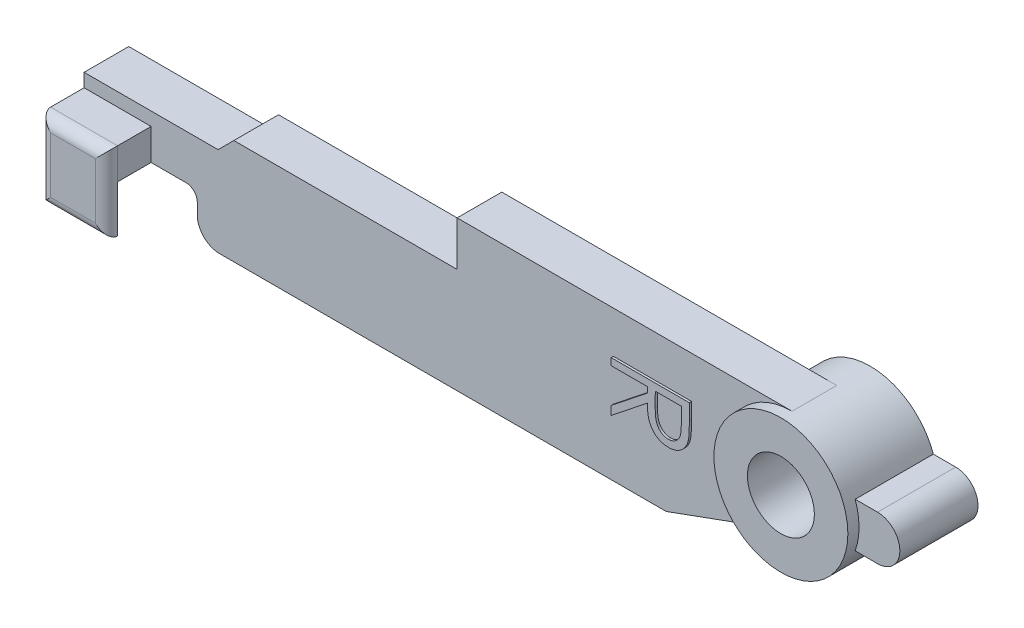
from build123d import *

# Parameters (mm, degrees)
ESTRUSIONE_ESTRUSIONE1_DEPTH             = 2
RACCORDO1_R                              = 1
RACCORDO2_R                              = 0.5
ESTRUSIONE_ESTRUSIONE2_DEPTH             = 2.5
ESTRUSIONE_ESTRUSIONE2_DEPTH_BACK        = 1.5
SCHIZZO2_R                               = 3
ESTRUSIONE_ESTRUSIONE3_REACH             = 20.507
ESTRUSIONE_ESTRUSIONE3_DIRECTION_2_REACH = 20.507
ESTRUSIONE_ESTRUSIONE4_DEPTH             = 3
RACCORDO3_R                              = 0.5
SCHIZZO5_R                               = 1.5
TAGLIO_ESTRUSIONE1_DEPTH                 = 21.528432045
ESTRUSIONE_ESTRUSIONE5_DEPTH             = 0.1


with BuildPart() as part:
    # Schizzo1 → Estrusione-Estrusione1 (new body)
    with BuildSketch(Plane.XY):
        Polygon((-16.707106781, 0.792893219), (-10.707106781, 0.792893219), (-10, 1.5), (0, 1.5), (0, 3.5), (15, 3.5), (15, 0), (15, -1.154985921), (9.361844275, -3.207106781), (-11.638155725, -3.207106781), (-11.638155725, -1.207106781), (-16.707106781, -1.207106781), align=None)
    extrude(amount=ESTRUSIONE_ESTRUSIONE1_DEPTH)

    # Raccordo1
    raccordo1_edges = [part.edges().sort_by_distance(p)[0] for p in [
        (-11.638155725, -3.207106781, 1),
    ]]
    fillet(raccordo1_edges, radius=RACCORDO1_R)

    # Raccordo2
    raccordo2_edges = [part.edges().sort_by_distance(p)[0] for p in [
        (-11.638155725, -1.207106781, 1),
    ]]
    fillet(raccordo2_edges, radius=RACCORDO2_R)

    # Schizzo2 → Estrusione-Estrusione2 (add, two sides: drawn at the far end of the back side and taken through both)
    with BuildSketch(Plane.XY.offset(-ESTRUSIONE_ESTRUSIONE2_DEPTH_BACK)):
        with Locations((15, 0.5)):
            Circle(SCHIZZO2_R)
    extrude(amount=ESTRUSIONE_ESTRUSIONE2_DEPTH + ESTRUSIONE_ESTRUSIONE2_DEPTH_BACK)

    # Estrusione-Estrusione3: up to this face of the body (flat: up to its plane)
    estrusione_estrusione3_end = Plane(part.part.faces().sort_by_distance((0.378494116, -0.204899382, 2))[0])
    # Schizzo3 → Estrusione-Estrusione3 (add, up to the picked face)
    with BuildSketch(Plane.XY, mode=Mode.PRIVATE) as estrusione_estrusione3_sk1:
        with BuildLine():
            Line((18.828427125, 1.5), (17.828427125, 1.5))
            ThreePointArc((17.828427125, 1.5), (18, 0.5), (17.828427125, -0.5))
            Line((17.828427125, -0.5), (18.828427125, -0.5))
            ThreePointArc((18.828427125, -0.5), (19.828427125, 0.5), (18.828427125, 1.5))
        make_face()
    estrusione_estrusione3_tool1 = split(extrude(estrusione_estrusione3_sk1.sketch, amount=ESTRUSIONE_ESTRUSIONE3_REACH, mode=Mode.PRIVATE), bisect_by=estrusione_estrusione3_end, keep=Keep.BOTH, mode=Mode.PRIVATE)
    add(estrusione_estrusione3_tool1.solids().sort_by(Axis((18.792788, 0.5, 0), (0, 0, 1)))[0])

    # Estrusione-Estrusione3 direction 2: up to this face of the body (flat: up to its plane)
    estrusione_estrusione3_direction_2_end = Plane(part.part.faces().sort_by_distance((15, 0.5, -1.5))[0])
    # Schizzo3 → Estrusione-Estrusione3 direction 2 (add, up to the picked face)
    with BuildSketch(Plane.XY, mode=Mode.PRIVATE) as estrusione_estrusione3_direction_2_sk1:
        with BuildLine():
            Line((18.828427125, 1.5), (17.828427125, 1.5))
            ThreePointArc((17.828427125, 1.5), (18, 0.5), (17.828427125, -0.5))
            Line((17.828427125, -0.5), (18.828427125, -0.5))
            ThreePointArc((18.828427125, -0.5), (19.828427125, 0.5), (18.828427125, 1.5))
        make_face()
    estrusione_estrusione3_direction_2_tool1 = split(extrude(estrusione_estrusione3_direction_2_sk1.sketch, amount=-ESTRUSIONE_ESTRUSIONE3_DIRECTION_2_REACH, mode=Mode.PRIVATE), bisect_by=estrusione_estrusione3_direction_2_end, keep=Keep.BOTH, mode=Mode.PRIVATE)
    add(estrusione_estrusione3_direction_2_tool1.solids().sort_by(Axis((18.792788, 0.5, 0), (0, 0, -1)))[0])

    # Schizzo4 → Estrusione-Estrusione4 (add)
    with BuildSketch(Plane.ZY.offset(16.707106781)):
        Polygon((2, -1.207106781), (3.5, -1.207106781), (3.5, -3.307106781), (4, -3.307106781), (4, 0.192893219), (2, 0.192893219), align=None)
    extrude(amount=-ESTRUSIONE_ESTRUSIONE4_DEPTH)

    # Raccordo3
    raccordo3_edges = [part.edges().sort_by_distance(p)[0] for p in [
        (-15.207106781, 0.192893219, 4),
        (-13.707106781, -1.557106781, 4),
        (-15.207106781, -3.307106781, 4),
        (-16.707106781, -1.557106781, 4),
    ]]
    fillet(raccordo3_edges, radius=RACCORDO3_R - 0.0001)  # a hair under: the kernel refuses the full size

    # Schizzo5 → Taglio-Estrusione1 (cut, through all)
    with BuildSketch(Plane.XY.offset(2.5)):
        with Locations((15, 0.5)):
            Circle(SCHIZZO5_R)
    extrude(amount=-TAGLIO_ESTRUSIONE1_DEPTH, mode=Mode.SUBTRACT)

    # Schizzo6 → Estrusione-Estrusione5 (add)
    with BuildSketch(Plane.XY.offset(2)):
        with BuildLine():
            Line((10.5, 1.629867893), (10.5, 0.92944722))
            add(Edge.make_bspline(
                [(10.5, 0.92944722), (10.499844414, 0.882706092), (10.499545672, 0.792957947), (10.497879909, 0.664384677), (10.493105553, 0.54755758), (10.48899697, 0.442537741), (10.481505028, 0.349327086), (10.474344381, 0.267639795), (10.46497072, 0.197852097), (10.456265297, 0.155606246), (10.452323718, 0.13647847)],
                knots=[0, 0, 0, 0, 1.410062039, 2.707475311, 3.878576406, 4.937260626, 5.877586885, 6.699081471, 7.410979367, 8, 8, 8, 8], degree=3))
            add(Edge.make_bspline(
                [(10.452323718, 0.13647847), (10.44599767, 0.110871395), (10.433480527, 0.060203513), (10.407010513, -0.012740009), (10.376429305, -0.082278475), (10.340231746, -0.148150926), (10.299049203, -0.210363472), (10.252641058, -0.268822966), (10.200770974, -0.323195178), (10.144763494, -0.373898474), (10.084129937, -0.419859381), (10.019753567, -0.459632532), (9.952037023, -0.493690082), (9.88074449, -0.520879248), (9.80647863, -0.542752098), (9.72859096, -0.55817975), (9.647429673, -0.567430547), (9.592071808, -0.568372457), (9.564002404, -0.568850055)],
                knots=[0, 0, 0, 0, 1.02737288, 2.032829108, 3.019628684, 3.985738875, 4.958353778, 5.924249254, 6.890702889, 7.883913451, 8.865824512, 9.85161466, 10.829249435, 11.81541824, 12.821369441, 13.843154991, 14.906364023, 16, 16, 16, 16], degree=3))
            add(Edge.make_bspline(
                [(9.564002404, -0.568850055), (9.517367246, -0.567381095), (9.426369973, -0.564514774), (9.294309841, -0.537789138), (9.171117785, -0.494014565), (9.056965246, -0.433684102), (8.954017226, -0.356891178), (8.863900454, -0.264603546), (8.787792734, -0.157292512), (8.735576131, -0.056923958), (8.70197773, 0.031778426), (8.678219098, 0.105018096), (8.660172121, 0.18497086), (8.643769941, 0.270489675), (8.631253759, 0.362235095), (8.622364892, 0.460022369), (8.616649282, 0.564096068), (8.615814207, 0.635435829), (8.615384615, 0.672135521)],
                knots=[0, 0, 0, 0, 1.260402266, 2.459371274, 3.627181936, 4.786749125, 5.93865593, 7.087644312, 8.261344208, 9.485713728, 10.136162886, 10.825977872, 11.566646758, 12.35154167, 13.181268117, 14.0701832, 15.007234106, 16, 16, 16, 16], degree=3))
            Line((8.615384615, 0.672135521), (7, -0.61372185))
            Line((7, -0.61372185), (7, -0.225300376))
            Line((7, -0.225300376), (8.615384615, 1.060556996))
            Line((8.615384615, 1.060556996), (8.615384615, 1.315765329))
            Line((8.615384615, 1.315765329), (7, 1.315765329))
            Line((7, 1.315765329), (7, 1.629867893))
            Line((7, 1.629867893), (10.5, 1.629867893))
        make_face()
        with BuildLine():
            Line((10.141025641, 1.315765329), (8.974358974, 1.315765329))
            Line((8.974358974, 1.315765329), (8.969451122, 0.674940009))
            add(Edge.make_bspline(
                [(8.969451122, 0.674940009), (8.969437885, 0.64501997), (8.969412229, 0.587026413), (8.973406004, 0.503125746), (8.977949327, 0.425005641), (8.984898657, 0.352964869), (8.993854777, 0.286971357), (9.005057604, 0.227057739), (9.01811018, 0.173127354), (9.038309643, 0.110226003), (9.070330282, 0.040008487), (9.116838436, -0.036397556), (9.175714061, -0.101242729), (9.241967426, -0.157151837), (9.316309813, -0.200216089), (9.395441443, -0.23155931), (9.478679147, -0.251228927), (9.53585099, -0.253567367), (9.564703526, -0.254747491)],
                knots=[0, 0, 0, 0, 1.14660753, 2.222451964, 3.218720504, 4.145691244, 4.995719623, 5.770487122, 6.480909919, 7.121111896, 8.299844659, 9.430703709, 10.534634535, 11.641396424, 12.741395289, 13.810956493, 14.895269934, 16, 16, 16, 16], degree=3))
            add(Edge.make_bspline(
                [(9.564703526, -0.254747491), (9.592857905, -0.253563739), (9.648649611, -0.251217974), (9.730103047, -0.231521199), (9.807529909, -0.199713788), (9.879454388, -0.155112436), (9.94528638, -0.101218543), (10.000835297, -0.037211531), (10.047354277, 0.033685128), (10.076864421, 0.09999535), (10.094992971, 0.159223507), (10.107734135, 0.210655613), (10.118056983, 0.268990383), (10.126082803, 0.334088015), (10.133305124, 0.405830736), (10.137987885, 0.484414991), (10.140818147, 0.569750034), (10.140954867, 0.628897216), (10.141025641, 0.659515329)],
                knots=[0, 0, 0, 0, 1.100801541, 2.181386982, 3.260112282, 4.364594493, 5.481957178, 6.577424609, 7.668452592, 8.790448866, 9.403819393, 10.091598921, 10.863153553, 11.720938239, 12.658472417, 13.685008818, 14.801622349, 16, 16, 16, 16], degree=3))
            Line((10.141025641, 0.659515329), (10.141025641, 1.315765329))
        make_face(mode=Mode.SUBTRACT)
    extrude(amount=ESTRUSIONE_ESTRUSIONE5_DEPTH)


solid = part.part
